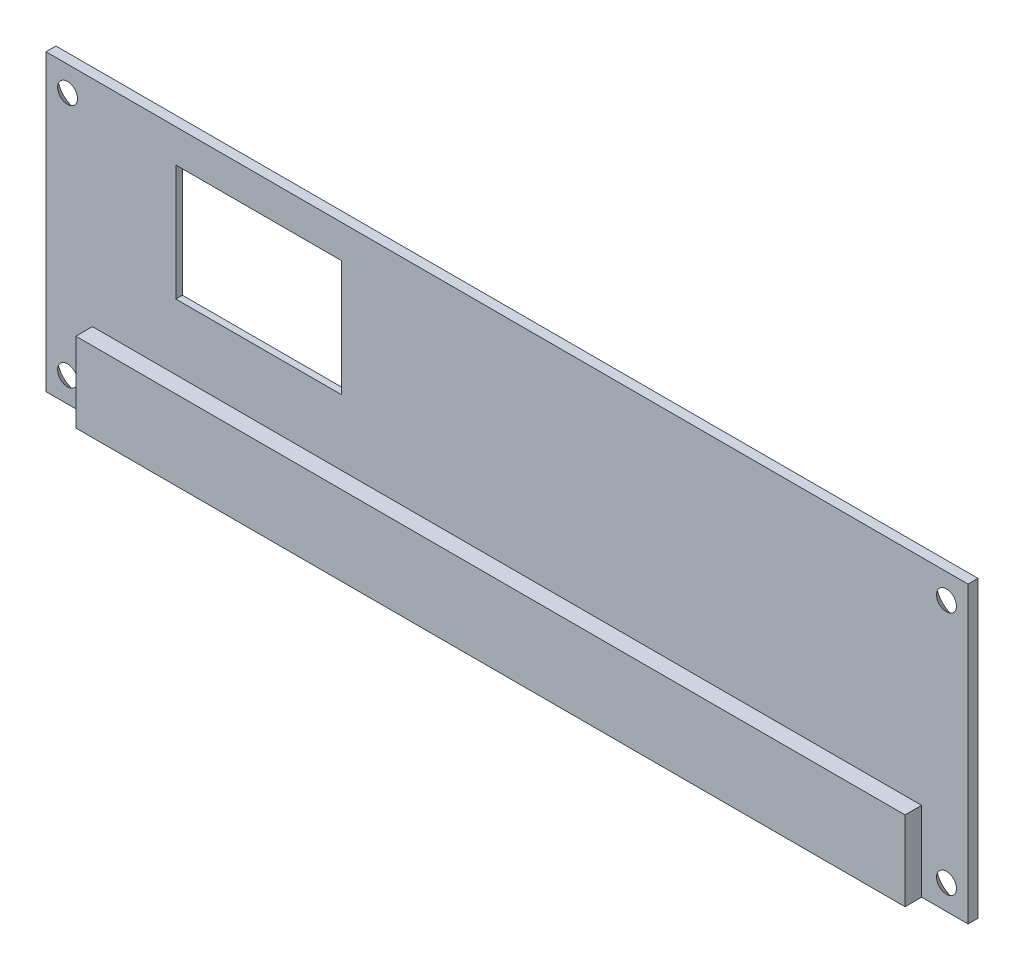
from build123d import *

# Parameters (mm, degrees)
SKETCH1_W                       = 112
SKETCH1_H                       = 35.5
BOSS_EXTRUDE1_DEPTH             = 1.2
SKETCH2_W                       = 6
SKETCH2_H                       = 6
BOSS_EXTRUDE2_DEPTH             = 2
SKETCH3_R                       = 1.1
CUT_EXTRUDE1_DEPTH              = 59.83283522
SKETCH5_W                       = 20
SKETCH5_H                       = 14
CUT_EXTRUDE3_DEPTH              = 59.83283522
CHAMFER1_SIZE                   = 0.4
CUT_EXTRUDE6_DEPTH              = 59.779779687
CUT_EXTRUDE6_DEPTH_BACK         = 59.779779687
SKETCH8_W                       = 0.4
SKETCH8_H                       = 35.5
SKIZZE1_W                       = 5.6
SKIZZE1_H                       = 23.5
AUFSATZ_LINEAR_AUSTRAGEN1_DEPTH = 2
SKETCH9_W                       = 5.6
SKETCH9_H                       = 35.5
CUT_EXTRUDE7_DEPTH              = 2
CHAMFER2_SIZE                   = 1.3


with BuildPart() as part:
    # Sketch1 → Boss-Extrude1 (new body)
    with BuildSketch(Plane.XY):
        Rectangle(SKETCH1_W, SKETCH1_H)
    extrude(amount=BOSS_EXTRUDE1_DEPTH)

    # Sketch2 → Boss-Extrude2 (add)
    with BuildSketch(Plane.XY.offset(1.2)):
        with Locations((-53, 14.75)):
            Rectangle(SKETCH2_W, SKETCH2_H)
        with Locations((-53, -14.75)):
            Rectangle(SKETCH2_W, SKETCH2_H)
        with Locations((53, -14.75)):
            Rectangle(SKETCH2_W, SKETCH2_H)
        with Locations((53, 14.75)):
            Rectangle(SKETCH2_W, SKETCH2_H)
    extrude(amount=BOSS_EXTRUDE2_DEPTH)

    # Sketch3 → Cut-Extrude1 (cut, through all)
    with BuildSketch(Plane.XY.offset(3.2)):
        with Locations((-53, 14.75)):
            Circle(SKETCH3_R)
        with Locations((-53, -14.75)):
            Circle(SKETCH3_R)
        with Locations((53, -14.75)):
            Circle(SKETCH3_R)
        with Locations((53, 14.75)):
            Circle(SKETCH3_R)
    extrude(amount=-CUT_EXTRUDE1_DEPTH, mode=Mode.SUBTRACT)

    # Sketch5 → Cut-Extrude3 (cut, through all)
    with BuildSketch(Plane(origin=(0, 0, 0), x_dir=(-1, 0, 0), z_dir=(0, 0, -1))):
        with Locations((29.95, 6.75)):
            Rectangle(SKETCH5_W, SKETCH5_H)
    extrude(amount=-CUT_EXTRUDE3_DEPTH, mode=Mode.SUBTRACT)

    # Chamfer1
    chamfer1_edges = [part.edges().sort_by_distance(p)[0] for p in [
        (-39.95, 6.75, 0),
        (-29.95, 13.75, 0),
        (-19.95, 6.75, 0),
        (-29.95, -0.25, 0),
    ]]
    chamfer(chamfer1_edges, length=CHAMFER1_SIZE)

    # Sketch8 → Cut-Extrude6 (cut, two sides: drawn at the far end of the back side and taken through both)
    with BuildSketch(Plane.XY.offset(1.2).offset(-CUT_EXTRUDE6_DEPTH_BACK)):
        with Locations((-55.8, 0)):
            Rectangle(SKETCH8_W, SKETCH8_H)
        with Locations((55.8, 0)):
            Rectangle(SKETCH8_W, SKETCH8_H)
    extrude(amount=CUT_EXTRUDE6_DEPTH + CUT_EXTRUDE6_DEPTH_BACK, mode=Mode.SUBTRACT)

    # Skizze1 → Aufsatz-Linear austragen1 (add)
    with BuildSketch(Plane.XY.offset(1.2)):
        Polygon((50, -8.156810447), (-50, -8.156810447), (-50, -11.75), (-50, -17.75), (50, -17.75), (50, -11.75), align=None)
        with Locations((-52.8, 0)):
            Rectangle(SKIZZE1_W, SKIZZE1_H)
        with Locations((52.8, 0)):
            Rectangle(SKIZZE1_W, SKIZZE1_H)
    extrude(amount=AUFSATZ_LINEAR_AUSTRAGEN1_DEPTH)

    # Sketch9 → Cut-Extrude7 (cut)
    with BuildSketch(Plane.XY.offset(1.2)):
        with Locations((-52.8, 0)):
            Rectangle(SKETCH9_W, SKETCH9_H)
        with Locations((52.8, 0)):
            Rectangle(SKETCH9_W, SKETCH9_H)
    extrude(amount=CUT_EXTRUDE7_DEPTH, mode=Mode.SUBTRACT)

    # Chamfer2
    # the kernel refuses this chamfer: 1.3 mm, written as the material it takes off along each edge
    with BuildSketch(Plane(origin=(-53, 14.75, 0), x_dir=(1, 0, 0), z_dir=(0, -1, 0))) as chamfer2_piece_1:
        Polygon((1.1 + CHAMFER2_SIZE, 0), (1.1, CHAMFER2_SIZE), (1.1, 0), align=None)
    revolve(axis=Axis((-53, 14.75, 0), (0, 0, 1)), mode=Mode.SUBTRACT)
    with BuildSketch(Plane(origin=(-53, -14.75, 0), x_dir=(1, 0, 0), z_dir=(0, -1, 0))) as chamfer2_piece_2:
        Polygon((1.1 + CHAMFER2_SIZE, 0), (1.1, CHAMFER2_SIZE), (1.1, 0), align=None)
    revolve(axis=Axis((-53, -14.75, 0), (0, 0, 1)), mode=Mode.SUBTRACT)
    with BuildSketch(Plane(origin=(53, -14.75, 0), x_dir=(1, 0, 0), z_dir=(0, -1, 0))) as chamfer2_piece_3:
        Polygon((1.1 + CHAMFER2_SIZE, 0), (1.1, CHAMFER2_SIZE), (1.1, 0), align=None)
    revolve(axis=Axis((53, -14.75, 0), (0, 0, 1)), mode=Mode.SUBTRACT)
    with BuildSketch(Plane(origin=(53, 14.75, 0), x_dir=(1, 0, 0), z_dir=(0, -1, 0))) as chamfer2_piece_4:
        Polygon((1.1 + CHAMFER2_SIZE, 0), (1.1, CHAMFER2_SIZE), (1.1, 0), align=None)
    revolve(axis=Axis((53, 14.75, 0), (0, 0, 1)), mode=Mode.SUBTRACT)


solid = part.part
